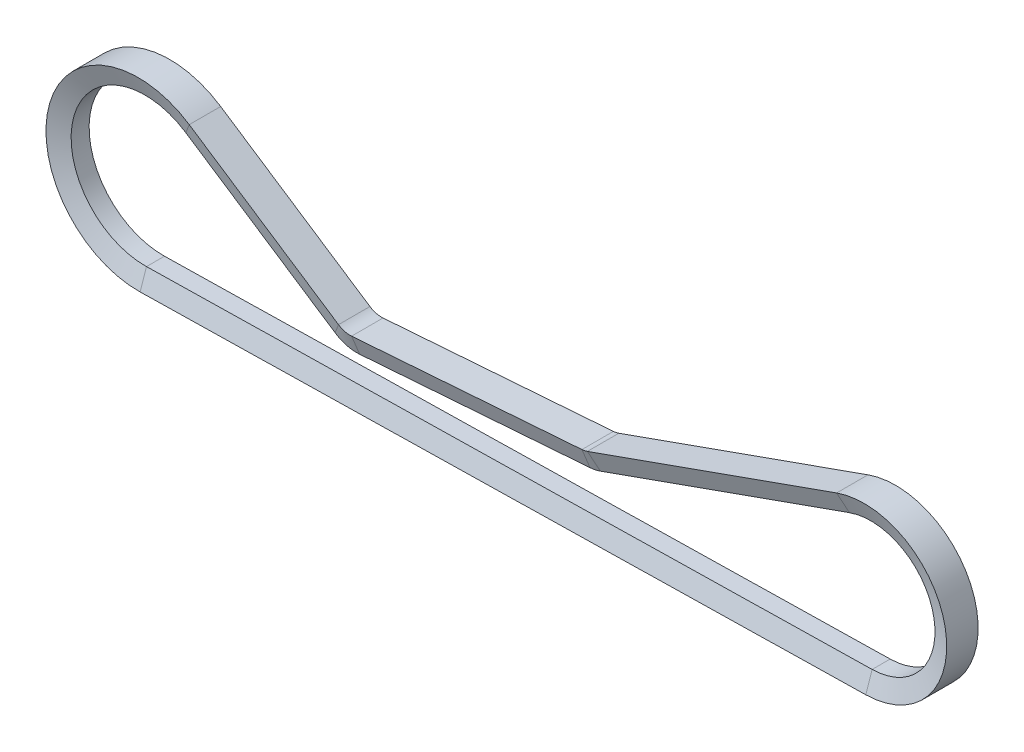
from build123d import *


with BuildPart() as part:
    # Sweep1: sweep along a path in Sketch2
    with BuildLine(Plane.XY) as sweep1_path:
        Line((0.481364088, -24.995365343), (-219.457399224, -29.230975453))
        ThreePointArc((-219.457399224, -29.230975453), (-246.88922977, 6.560149387), (-204.567771398, 22.129481604))
        Line((-204.567771398, 22.129481604), (-159.326743566, -7.743979022))
        ThreePointArc((-159.326743566, -7.743979022), (-157.42986236, -8.589546266), (-155.361606403, -8.777853375))
        Line((-155.361606403, -8.777853375), (-85.5504466, -3.639568936))
        ThreePointArc((-85.5504466, -3.639568936), (-84.708263246, -3.520462656), (-83.889553163, -3.289870145))
        Line((-83.889553163, -3.289870145), (-8.374052124, 23.55579018))
        ThreePointArc((-8.374052124, 23.55579018), (24.594253531, 4.485832502), (0.481364088, -24.995365343))
    # Sketch3 → Sweep1 (sweep)
    with BuildSketch(Plane(origin=(-8.374052124, 23.55579018, 0), x_dir=(0.334962084965419, -0.9422316072153489, 0), z_dir=(0.9422316072153489, 0.334962084965419, 0))):
        Polygon((0, -4.7625), (0, 4.7625), (5.588, 2.728634331), (5.588, -2.728634331), align=None)
    sweep(path=sweep1_path.line)


solid = part.part
